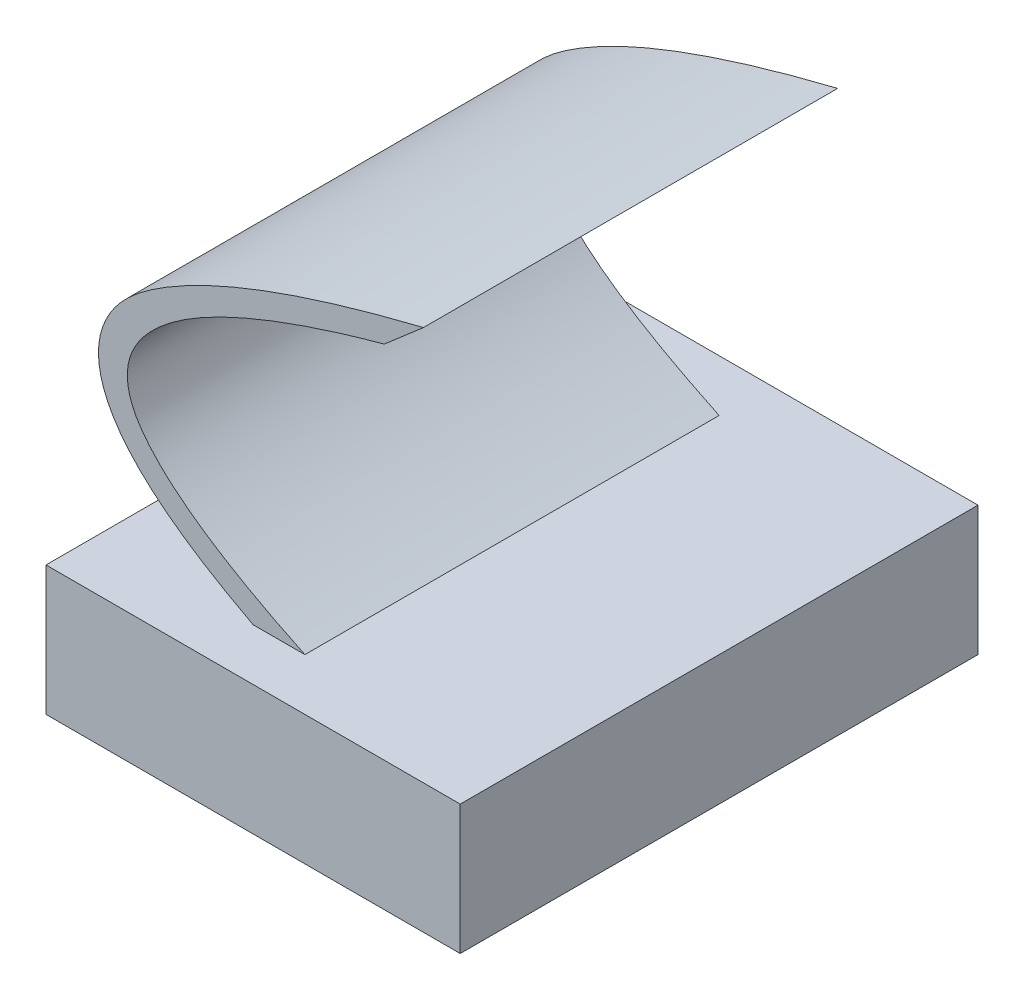
from build123d import *

# Parameters (mm, degrees)
SKETCH1_W           = 8
SKETCH1_H           = 10
BOSS_EXTRUDE1_DEPTH = 2.5
SWEEP1_START        = -5.901330619
SWEEP1_DEPTH        = 8


# Read off the part's stored shape, not the designer's step: Sweep1
with BuildPart() as part:
    # Sketch1 → Boss-Extrude1 (new body)
    with BuildSketch(Plane(origin=(0, 0, 0), x_dir=(1, 0, 0), z_dir=(0, 1, 0))):
        with Locations((-2.032255738, 1.901330619)):
            Rectangle(SKETCH1_W, SKETCH1_H)
    extrude(amount=BOSS_EXTRUDE1_DEPTH)

    # Sweep1 outline → Sweep1 (add)
    with BuildSketch(Plane.XY.offset(SWEEP1_START)):
        with BuildLine():
            add(Edge.make_bspline(
                [(-3.032255738, 2.5), (-4.266040076, 3.148812394), (-5.164806735, 3.796471173), (-5.892265813, 4.851667309), (-6.028080412, 5.224532796), (-6.009599546, 5.968259567), (-5.842449804, 6.323792462), (-5.353255138, 6.881528551), (-5.051527216, 7.098135879), (-4.363406409, 7.516796991), (-3.967467158, 7.717864322), (-2.559323267, 8.324221481), (-1.325123196, 8.726016628), (0.257582784, 9.115538374)],
                knots=[0, 0, 0, 0, 0.25, 0.25, 0.375, 0.375, 0.5, 0.5, 0.625, 0.625, 0.75, 0.75, 1, 1, 1, 1], degree=3))
            Line((-3.032255738, 2.5), (-2.032255738, 2.5))
            add(Edge.make_bspline(
                [(-2.032255738, 2.5), (-3.270659518, 3.087311106), (-4.155812024, 3.645608381), (-4.986574857, 4.415856173), (-5.181541832, 4.659428114), (-5.428760083, 5.132438869), (-5.484559921, 5.366109249), (-5.416116362, 5.861091927), (-5.286264235, 6.118427807), (-4.827128931, 6.622430819), (-4.500481131, 6.869370272), (-3.247155556, 7.587287997), (-2.04756532, 8.037218279), (-0.498558678, 8.461130176)],
                knots=[0, 0, 0, 0, 0.25, 0.25, 0.375, 0.375, 0.5, 0.5, 0.625, 0.625, 0.75, 0.75, 1, 1, 1, 1], degree=3))
            Line((-0.498558678, 8.461130176), (0.257582784, 9.115538374))
        make_face()
    extrude(amount=SWEEP1_DEPTH)


solid = part.part
